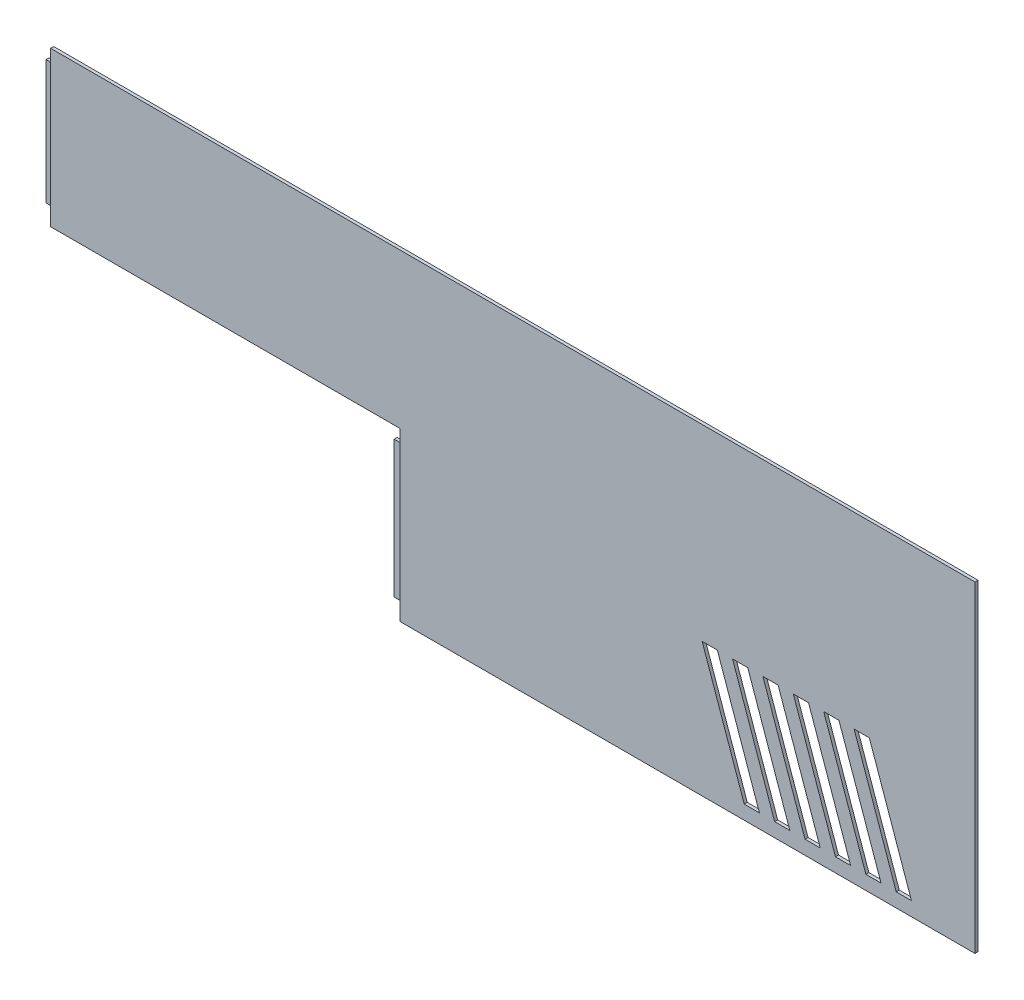
from build123d import *

# Parameters (mm, degrees)
BOSS_EXTRU_1_DEPTH      = 1
ESQUISSE2_W             = 5
ESQUISSE2_H             = 40.838750305
ESQUISSE2_H_2           = 45
BOSS_EXTRU_2_DEPTH      = 1
ESQUISSE3_W             = 125.749218941
ESQUISSE3_H             = 2
ESQUISSE3_W_2           = 13
BOSS_EXTRU_3_DEPTH      = 2
CHANFREIN1_SIZE         = 1.5
CHANFREIN2_SIZE         = 1
ENL_V_MAT_EXTRU_1_DEPTH = 339.434208864


with BuildPart() as part:
    # Esquisse1 → Boss.-Extru.1 (new body)
    with BuildSketch(Plane.XY):
        Polygon((-318.4, 56.6), (-203.4, 56.6), (-203.4, 1.6), (-14.350781059, 1.6), (-14.350781059, 107.438750305), (-318.4, 107.438750305), align=None)
    extrude(amount=-BOSS_EXTRU_1_DEPTH)

    # Esquisse2 → Boss.-Extru.2 (add)
    with BuildSketch(Plane(origin=(0, 0, -1), x_dir=(-1, 0, 0), z_dir=(0, 0, -1))):
        with Locations((318.421530381, 82.019375153)):
            Rectangle(ESQUISSE2_W, ESQUISSE2_H)
        with Locations((203.9, 29.1)):
            Rectangle(ESQUISSE2_W, ESQUISSE2_H_2)
    extrude(amount=BOSS_EXTRU_2_DEPTH)

    # Esquisse3 → Boss.-Extru.3 (add)
    with BuildSketch(Plane(origin=(0, 0, -1), x_dir=(-1, 0, 0), z_dir=(0, 0, -1))):
        with Locations((87.22539053, 57.6)):
            Rectangle(ESQUISSE3_W, ESQUISSE3_H)
        with Locations((87.22539053, 54)):
            Rectangle(ESQUISSE3_W, ESQUISSE3_H)
        with Locations((191.9, 57.6)):
            Rectangle(ESQUISSE3_W_2, ESQUISSE3_H)
        with Locations((191.9, 54)):
            Rectangle(ESQUISSE3_W_2, ESQUISSE3_H)
    extrude(amount=BOSS_EXTRU_3_DEPTH)

    # Chanfrein1
    chanfrein1_edges = [part.edges().sort_by_distance(p)[0] for p in [
        (-87.22539053, 58.6, -3),
        (-87.22539053, 53, -3),
        (-191.9, 58.6, -3),
        (-191.9, 53, -3),
    ]]
    chamfer(chanfrein1_edges, length=CHANFREIN1_SIZE)

    # Chanfrein2
    chanfrein2_edges = [part.edges().sort_by_distance(p)[0] for p in [
        (-201.4, 29.1, -1),
        (-315.921530381, 82.019375153, -1),
    ]]
    chamfer(chanfrein2_edges, length=CHANFREIN2_SIZE - 0.0001)  # a hair under: the kernel refuses the full size

    # Esquisse4 → Enlèv. mat.-Extru.1 (cut, through all)
    with BuildSketch(Plane(origin=(0, 0, -1), x_dir=(-1, 0, 0), z_dir=(0, 0, -1))):
        Polygon((90.245471521, 6.206378309), (85.245471521, 6.206378309), (99.094461568, 45.651267323), (104.094461568, 45.651267323), align=None)
        Polygon((94.094461568, 45.651267323), (80.245471521, 6.206378309), (75.245471521, 6.206378309), (89.094461568, 45.651267323), align=None)
        Polygon((84.094461568, 45.651267323), (70.245471521, 6.206378309), (65.245471521, 6.206378309), (79.094461568, 45.651267323), align=None)
        Polygon((74.094461568, 45.651267323), (60.245471521, 6.206378309), (55.245471521, 6.206378309), (69.094461568, 45.651267323), align=None)
        Polygon((64.094461568, 45.651267323), (50.245471521, 6.206378309), (45.245471521, 6.206378309), (59.094461568, 45.651267323), align=None)
        Polygon((54.094461568, 45.651267323), (40.245471521, 6.206378309), (35.245471521, 6.206378309), (49.094461568, 45.651267323), align=None)
    extrude(amount=-ENL_V_MAT_EXTRU_1_DEPTH, mode=Mode.SUBTRACT)


solid = part.part
